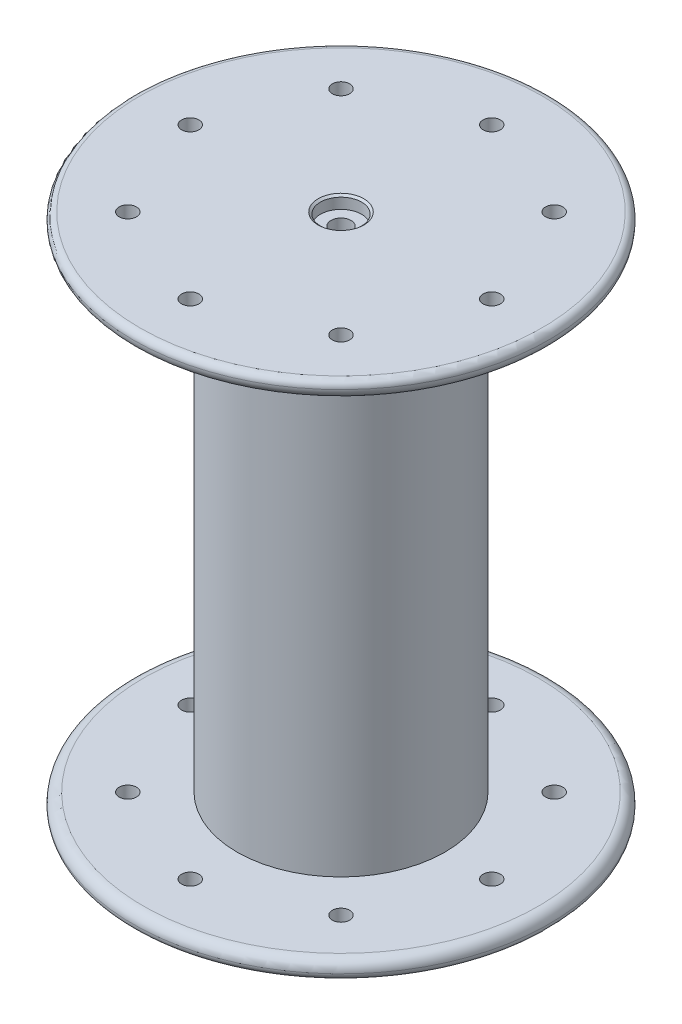
from build123d import *

# Parameters (mm, degrees)
SKETCH1_R               = 30
BOSS_EXTRUDE1_DEPTH     = 70
SKETCH2_R               = 60
BOSS_EXTRUDE2_DEPTH     = 5
FILLET1_R               = 2
FILLET5_R               = 3
SKETCH6_R               = 2.5
CUT_EXTRUDE1_DEPTH      = 169.0029762
CIRPATTERN1_COUNT       = 8
MIRROR1_COPY_1_SKETCH_R = 2.5
MIRROR1_COPY_1_DEPTH    = 169.0029762
MIRROR1_COPY_2_SKETCH_R = 2.5
MIRROR1_COPY_2_DEPTH    = 169.0029762
MIRROR1_COPY_3_SKETCH_R = 2.5
MIRROR1_COPY_3_DEPTH    = 169.0029762
MIRROR1_COPY_4_SKETCH_R = 2.5
MIRROR1_COPY_4_DEPTH    = 169.0029762
MIRROR1_COPY_5_SKETCH_R = 2.5
MIRROR1_COPY_5_DEPTH    = 169.0029762
MIRROR1_COPY_6_SKETCH_R = 2.5
MIRROR1_COPY_6_DEPTH    = 169.0029762
MIRROR1_COPY_7_SKETCH_R = 2.5
MIRROR1_COPY_7_DEPTH    = 169.0029762
FILLET1_OF_MIRROR1_R    = 2
FILLET5_OF_MIRROR1_R    = 3


with BuildPart() as part:
    # Sketch1 → Boss-Extrude1 (new, symmetric)
    with BuildSketch(Plane(origin=(0, 0, 0), x_dir=(1, 0, 0), z_dir=(0, 1, 0))):
        with Locations(Location((0, 0, 0), (0, 0, 270))):
            Circle(SKETCH1_R)
    extrude(amount=BOSS_EXTRUDE1_DEPTH, both=True)

    # Sketch2 → Boss-Extrude2 (add)
    with BuildSketch(Plane(origin=(0, 70, 0), x_dir=(1, 0, 0), z_dir=(0, 1, 0))):
        with Locations(Location((0, 0, 0), (0, 0, 270))):
            Circle(SKETCH2_R)
    boss_extrude2 = extrude(amount=BOSS_EXTRUDE2_DEPTH)

    # Fillet1
    fillet1_edges = [part.edges().sort_by_distance(p)[0] for p in [
        (0, 75, -60),
    ]]
    fillet(fillet1_edges, radius=FILLET1_R)

    # Fillet5
    fillet5_edges = [part.edges().sort_by_distance(p)[0] for p in [
        (0, 70, -60),
    ]]
    fillet(fillet5_edges, radius=FILLET5_R - 0.0001)  # a hair under: the kernel refuses the full size

    # Sketch5 → CBORE for #12 Binding Head Machine Screw1 (revolve, cut)
    with BuildSketch(Plane(origin=(0, 75, 0), x_dir=(0, 0, 1), z_dir=(1, 0, 0))):
        Polygon((0, 0), (0, 150), (2.8956, 150), (2.8956, 3.5814), (5.95376, 3.5814), (5.95376, 0.532828266), (6.58876, 0), align=None)
    cbore_for_12_binding_head_machine_screw = revolve(axis=Axis((0, 81.35, 0), (0, -1, 0)), mode=Mode.SUBTRACT)

    # Sketch6 → Cut-Extrude1 (cut, through all)
    with BuildSketch(Plane(origin=(0, 75, 0), x_dir=(1, 0, 0), z_dir=(0, 1, 0))):
        with Locations(Location((0, 43.5, 0), (0, 0, 270))):
            Circle(SKETCH6_R)
    cut_extrude1 = extrude(amount=-CUT_EXTRUDE1_DEPTH, mode=Mode.SUBTRACT)

    # CirPattern1: Cut-Extrude1 ×8 about axis
    cirpattern1_axis = Axis((0, 0, 0), (0, 1, 0))
    for i in range(1, CIRPATTERN1_COUNT):
        add(cut_extrude1.rotate(cirpattern1_axis, i * 360 / CIRPATTERN1_COUNT), mode=Mode.SUBTRACT)

    # Mirror1: Boss-Extrude2, CBORE for #12 Binding Head Machine Screw1, Cut-Extrude1 across plane
    add(boss_extrude2.mirror(Plane.ZX))
    add(cbore_for_12_binding_head_machine_screw.mirror(Plane.ZX), mode=Mode.SUBTRACT)
    add(cut_extrude1.mirror(Plane.ZX), mode=Mode.SUBTRACT)

    # Mirror1 copy 1 sketch → Mirror1 copy 1 (cut, through all)
    with BuildSketch(Plane(origin=(0, -75, 0), x_dir=(0.7071067811865476, 0, -0.7071067811865475), z_dir=(0, -1, 0))):
        with Locations((0, -43.5)):
            Circle(MIRROR1_COPY_1_SKETCH_R)
    extrude(amount=-MIRROR1_COPY_1_DEPTH, mode=Mode.SUBTRACT)

    # Mirror1 copy 2 sketch → Mirror1 copy 2 (cut, through all)
    with BuildSketch(Plane(origin=(0, -75, 0), x_dir=(0, 0, -1), z_dir=(0, -1, 0))):
        with Locations((0, -43.5)):
            Circle(MIRROR1_COPY_2_SKETCH_R)
    extrude(amount=-MIRROR1_COPY_2_DEPTH, mode=Mode.SUBTRACT)

    # Mirror1 copy 3 sketch → Mirror1 copy 3 (cut, through all)
    with BuildSketch(Plane(origin=(0, -75, 0), x_dir=(-0.7071067811865475, 0, -0.7071067811865476), z_dir=(0, -1, 0))):
        with Locations((0, -43.5)):
            Circle(MIRROR1_COPY_3_SKETCH_R)
    extrude(amount=-MIRROR1_COPY_3_DEPTH, mode=Mode.SUBTRACT)

    # Mirror1 copy 4 sketch → Mirror1 copy 4 (cut, through all)
    with BuildSketch(Plane(origin=(0, -75, 0), x_dir=(-1, 0, 0), z_dir=(0, -1, 0))):
        with Locations((0, -43.5)):
            Circle(MIRROR1_COPY_4_SKETCH_R)
    extrude(amount=-MIRROR1_COPY_4_DEPTH, mode=Mode.SUBTRACT)

    # Mirror1 copy 5 sketch → Mirror1 copy 5 (cut, through all)
    with BuildSketch(Plane(origin=(0, -75, 0), x_dir=(-0.7071067811865477, 0, 0.7071067811865475), z_dir=(0, -1, 0))):
        with Locations((0, -43.5)):
            Circle(MIRROR1_COPY_5_SKETCH_R)
    extrude(amount=-MIRROR1_COPY_5_DEPTH, mode=Mode.SUBTRACT)

    # Mirror1 copy 6 sketch → Mirror1 copy 6 (cut, through all)
    with BuildSketch(Plane(origin=(0, -75, 0), x_dir=(0, 0, 1), z_dir=(0, -1, 0))):
        with Locations((0, -43.5)):
            Circle(MIRROR1_COPY_6_SKETCH_R)
    extrude(amount=-MIRROR1_COPY_6_DEPTH, mode=Mode.SUBTRACT)

    # Mirror1 copy 7 sketch → Mirror1 copy 7 (cut, through all)
    with BuildSketch(Plane(origin=(0, -75, 0), x_dir=(0.7071067811865474, 0, 0.7071067811865477), z_dir=(0, -1, 0))):
        with Locations((0, -43.5)):
            Circle(MIRROR1_COPY_7_SKETCH_R)
    extrude(amount=-MIRROR1_COPY_7_DEPTH, mode=Mode.SUBTRACT)

    # Fillet1 of Mirror1
    fillet1_of_mirror1_edges = [part.edges().sort_by_distance(p)[0] for p in [
        (0, -75, -60),
    ]]
    fillet(fillet1_of_mirror1_edges, radius=FILLET1_OF_MIRROR1_R)

    # Fillet5 of Mirror1
    fillet5_of_mirror1_edges = [part.edges().sort_by_distance(p)[0] for p in [
        (0, -70, -60),
    ]]
    fillet(fillet5_of_mirror1_edges, radius=FILLET5_OF_MIRROR1_R - 0.0001)  # a hair under: the kernel refuses the full size


solid = part.part
